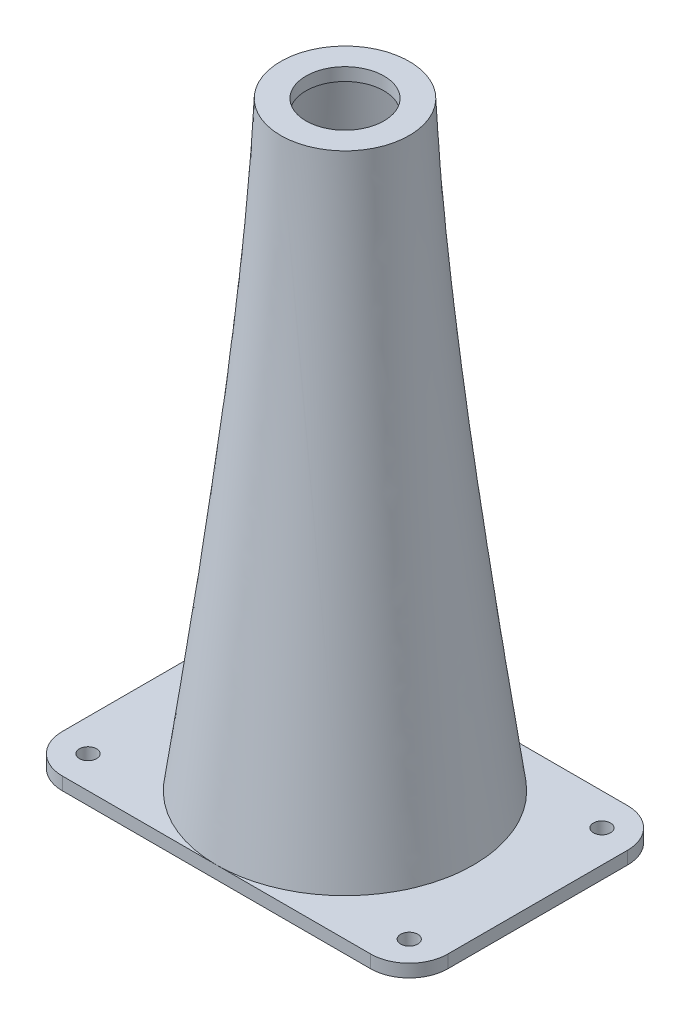
from build123d import *

# Parameters (mm, degrees)
SKETCH43_R          = 27.5
CUT_EXTRUDE4_DEPTH  = 140
CUT_EXTRUDE4_DRAFT  = -6
SKETCH44_R          = 15
SKETCH44_R_2        = 9.1
BOSS_EXTRUDE1_DEPTH = 3
SKETCH45_R          = 27.5
SKETCH45_R_2        = 2
SKETCH45_R_3        = 7.5
BOSS_EXTRUDE2_DEPTH = 3
FILLET1_R           = 9


with BuildPart() as part:
    # Loft2: read off the stored shape, not the designer's step
    # Loft2: loft between two sections, ruled curve by curve
    loft2_from = [
        Edge.make_bspline([(10.752198871, 140, 10.458977935), (-10.165756999, 140, 31.963375676), (-31.670154741, 140, 11.045419807), (-10.752198871, 140, -10.458977935), (10.165756999, 140, -31.963375676), (31.670154741, 140, -11.045419807), (10.752198871, 140, 10.458977935)], [0, 0, 0, 0, 0.5, 0.5, 0.5, 1, 1, 1, 1], 3, [1, 0.333333333, 0.333333333, 1, 0.333333333, 0.333333333, 1]),
    ]
    loft2_to = [
        Edge.make_bspline([(29.992325723, 0, -0.67852615), (31.349378022, 0, 59.306125296), (-28.635273424, 0, 60.663177595), (-29.992325723, 0, 0.67852615), (-31.349378022, 0, -59.306125296), (28.635273424, 0, -60.663177595), (29.992325723, 0, -0.67852615)], [0, 0, 0, 0, 0.5, 0.5, 0.5, 1, 1, 1, 1], 3, [1, 0.333333333, 0.333333333, 1, 0.333333333, 0.333333333, 1]),
    ]
    loft2 = Solid(Shell([*[Face.make_surface_from_curves(loft2_from[k], loft2_to[k]) for k in range(1)], Face(Wire(loft2_from)), Face(Wire(loft2_to))]))
    add(loft2)


with BuildPart() as cut_extrude4_tool:
    # Sketch43 → Cut-Extrude4 (with draft: the straight prism first)
    with BuildSketch(Plane.XZ):
        Circle(SKETCH43_R)
    extrude(amount=-CUT_EXTRUDE4_DEPTH)
    # Cut-Extrude4: the draft: its side faces are tilted about the plane it starts from
    cut_extrude4_sides = [cut_extrude4_tool.faces().sort_by_distance(p)[0] for p in [
        (-27.5, 70, 0),
    ]]
    draft(cut_extrude4_sides, Plane.XZ, CUT_EXTRUDE4_DRAFT)


with BuildPart() as part_1:
    add(part.part)

    # Cut-Extrude4: cut by cut_extrude4_tool
    add(cut_extrude4_tool.part, mode=Mode.SUBTRACT)

    # Sketch44 → Boss-Extrude1 (add)
    with BuildSketch(Plane(origin=(0, 140, 0), x_dir=(1, 0, 0), z_dir=(0, 1, 0))):
        Circle(SKETCH44_R)
        with Locations(Location((0, 0, 0), (0, 0, 270))):
            Circle(SKETCH44_R_2, mode=Mode.SUBTRACT)
    extrude(amount=-BOSS_EXTRUDE1_DEPTH)

    # Sketch45 → Boss-Extrude2 (add)
    # profile 1 of 5: a face of its own
    with BuildSketch(Plane.XZ):
        with BuildLine():
            add(Edge.make_bspline(
                [(-4.41e-07, 30), (-19.624983867, 29.999999712), (-29.658785994, 15.421704743), (-29.992325723, 0.67852615), (-30.337377244, -14.573498583), (-20.37899569, -30.000000339), (5e-07, -30)],
                knots=[0.252827556, 0.252827556, 0.252827556, 0.252827556, 0.5, 0.5, 0.5, 0.752827556, 0.752827556, 0.752827556, 0.752827556], degree=3, weights=[0.500063961, 0.503791395, 0.670436741, 1, 0.662896592, 0.496251245, 0.500063961]))
            add(Edge.make_bspline(
                [(5e-07, -30), (19.624983894, -29.999999673), (29.658785994, -15.421704721), (29.992325723, -0.67852615)],
                knots=[0.752827556, 0.752827556, 0.752827556, 0.752827556, 1, 1, 1, 1], degree=3, weights=[0.500063961, 0.503791395, 0.670436741, 1]))
            add(Edge.make_bspline(
                [(29.992325723, -0.67852615), (30.337377244, 14.573498561), (20.378995716, 30.000000299), (-4.41e-07, 30)],
                knots=[0, 0, 0, 0, 0.252827556, 0.252827556, 0.252827556, 0.252827556], degree=3, weights=[1, 0.662896592, 0.496251246, 0.500063961]))
        make_face()
        with Locations(Location((0, 0, 0), (0, 0, 270))):
            Circle(SKETCH45_R, mode=Mode.SUBTRACT)
    # profile 2 of 5: a face of its own
    with BuildSketch(Plane.XZ):
        with BuildLine():
            add(Edge.make_bspline(
                [(5e-07, -30), (19.624983894, -29.999999673), (29.658785994, -15.421704721), (29.992325723, -0.67852615)],
                knots=[0.752827556, 0.752827556, 0.752827556, 0.752827556, 1, 1, 1, 1], degree=3, weights=[0.500063961, 0.503791395, 0.670436741, 1]))
            Line((5e-07, -30), (45, -30))
            Line((45, -30), (45, 22.5))
            ThreePointArc((45, 22.5), (32.196699141, 17.196699141), (37.5, 30))
            Line((37.5, 30), (-4.41e-07, 30))
            add(Edge.make_bspline(
                [(29.992325723, -0.67852615), (30.337377244, 14.573498561), (20.378995716, 30.000000299), (-4.41e-07, 30)],
                knots=[0, 0, 0, 0, 0.252827556, 0.252827556, 0.252827556, 0.252827556], degree=3, weights=[1, 0.662896592, 0.496251246, 0.500063961]))
        make_face()
        with Locations(Location((37.5, -22.5, 0), (0, 0, 270))):
            Circle(SKETCH45_R_2, mode=Mode.SUBTRACT)
    # profile 3 of 5: a face of its own
    with BuildSketch(Plane.XZ):
        with BuildLine():
            Line((-45, 30), (-45, -30))
            Line((-45, -30), (5e-07, -30))
            add(Edge.make_bspline(
                [(-4.41e-07, 30), (-19.624983867, 29.999999712), (-29.658785994, 15.421704743), (-29.992325723, 0.67852615), (-30.337377244, -14.573498583), (-20.37899569, -30.000000339), (5e-07, -30)],
                knots=[0.252827556, 0.252827556, 0.252827556, 0.252827556, 0.5, 0.5, 0.5, 0.752827556, 0.752827556, 0.752827556, 0.752827556], degree=3, weights=[0.500063961, 0.503791395, 0.670436741, 1, 0.662896592, 0.496251245, 0.500063961]))
            Line((-4.41e-07, 30), (-45, 30))
        make_face()
        with Locations(Location((-37.5, -22.5, 0), (0, 0, 270))):
            Circle(SKETCH45_R_2, mode=Mode.SUBTRACT)
        with Locations(Location((-37.5, 22.5, 0), (0, 0, 270))):
            Circle(SKETCH45_R_2, mode=Mode.SUBTRACT)
    # profile 4 of 5: a face of its own
    with BuildSketch(Plane.XZ):
        with Locations((37.5, 22.5)):
            Circle(SKETCH45_R_3)
        with Locations(Location((37.5, 22.5, 0), (0, 0, 270))):
            Circle(SKETCH45_R_2, mode=Mode.SUBTRACT)
    # profile 5 of 5: a face of its own
    with BuildSketch(Plane.XZ):
        with BuildLine():
            ThreePointArc((37.5, 30), (42.803300859, 27.803300859), (45, 22.5))
            Line((45, 22.5), (45, 30))
            Line((45, 30), (37.5, 30))
        make_face()
    extrude(amount=BOSS_EXTRUDE2_DEPTH)

    # Fillet1
    fillet1_edges = [part_1.edges().sort_by_distance(p)[0] for p in [
        (45, -1.5, 30),
        (45, -1.5, -30),
        (-45, -1.5, -30),
        (-45, -1.5, 30),
    ]]
    fillet(fillet1_edges, radius=FILLET1_R)


solid = part_1.part
